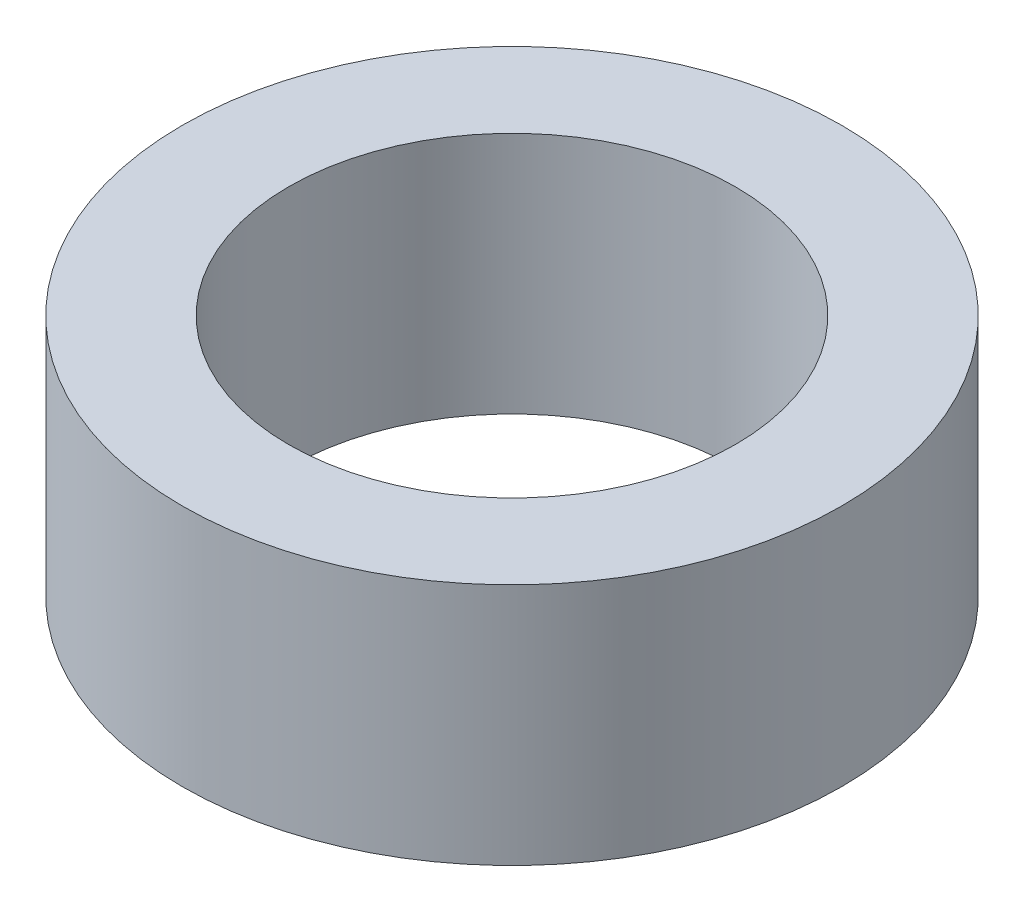
from build123d import *

# Parameters (mm, degrees)
SKETCH1_R           = 5.425
SKETCH1_R_2         = 3.675
BOSS_EXTRUDE1_DEPTH = 4


with BuildPart() as part:
    # Sketch1 → Boss-Extrude1 (new body)
    with BuildSketch(Plane(origin=(0, 0, 0), x_dir=(1, 0, 0), z_dir=(0, 1, 0))):
        Circle(SKETCH1_R)
        Circle(SKETCH1_R_2, mode=Mode.SUBTRACT)
    extrude(amount=BOSS_EXTRUDE1_DEPTH)


solid = part.part
